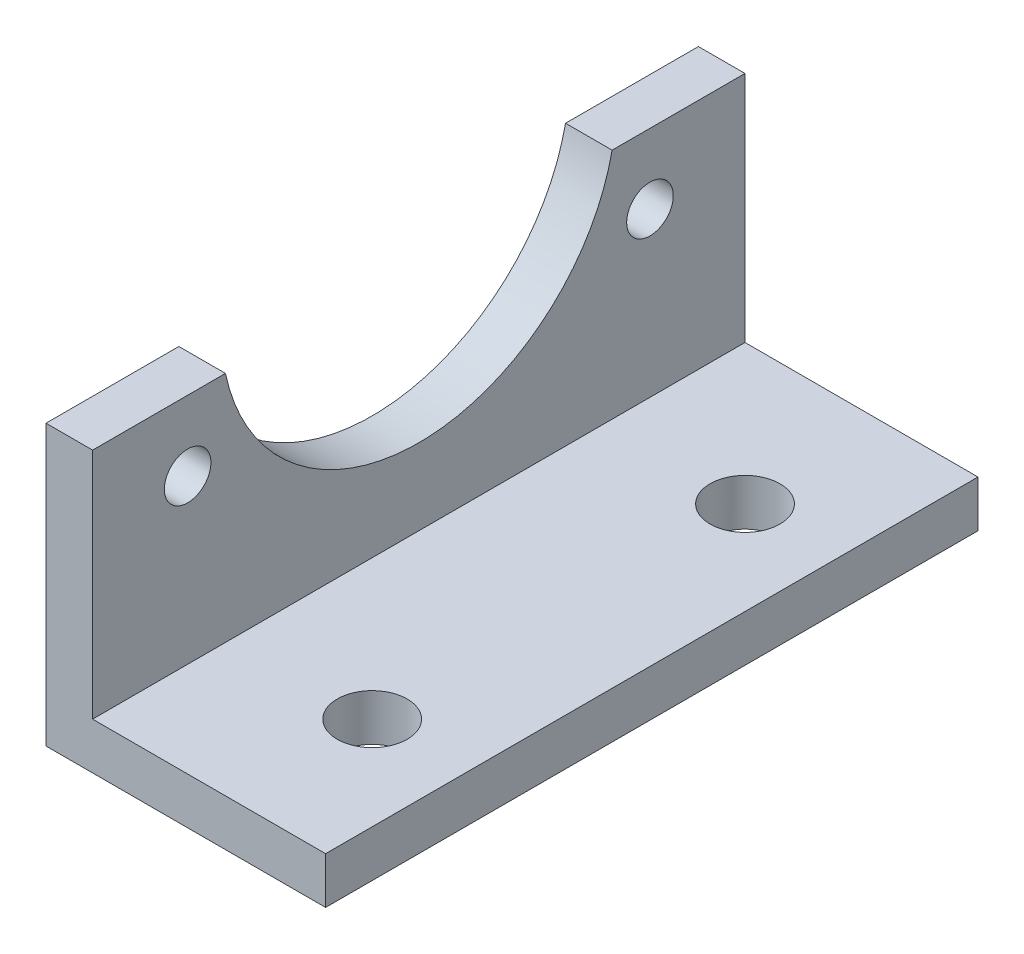
from build123d import *

# Parameters (mm, degrees)
BOSS_EXTRUDE1_DEPTH = 88.9
SKETCH2_R           = 3.175
CUT_EXTRUDE1_DEPTH  = 76.2
SKETCH3_R           = 4.7625
CUT_EXTRUDE2_DEPTH  = 104.953980203


with BuildPart() as part:
    # Sketch1 → Boss-Extrude1 (new body)
    with BuildSketch(Plane.XY):
        Polygon((0, 0), (0, 38.1), (6.35, 38.1), (6.35, 6.35), (38.1, 6.35), (38.1, 0), align=None)
    extrude(amount=BOSS_EXTRUDE1_DEPTH)

    # Sketch2 → Cut-Extrude1 (cut)
    with BuildSketch(Plane.ZY):
        with BuildLine():
            ThreePointArc((18.104961724, 38.1), (44.45, 16.733289595), (70.795038276, 38.1))
            Line((70.795038276, 38.1), (18.104961724, 38.1))
        make_face()
        with Locations((75.95, 28.575)):
            Circle(SKETCH2_R)
        with Locations((12.95, 28.575)):
            Circle(SKETCH2_R)
    extrude(amount=-CUT_EXTRUDE1_DEPTH, mode=Mode.SUBTRACT)

    # Sketch3 → Cut-Extrude2 (cut, through all)
    with BuildSketch(Plane.XZ):
        with Locations((25.4, 69.85)):
            Circle(SKETCH3_R)
        with Locations((25.4, 19.05)):
            Circle(SKETCH3_R)
    extrude(amount=-CUT_EXTRUDE2_DEPTH, mode=Mode.SUBTRACT)


solid = part.part
